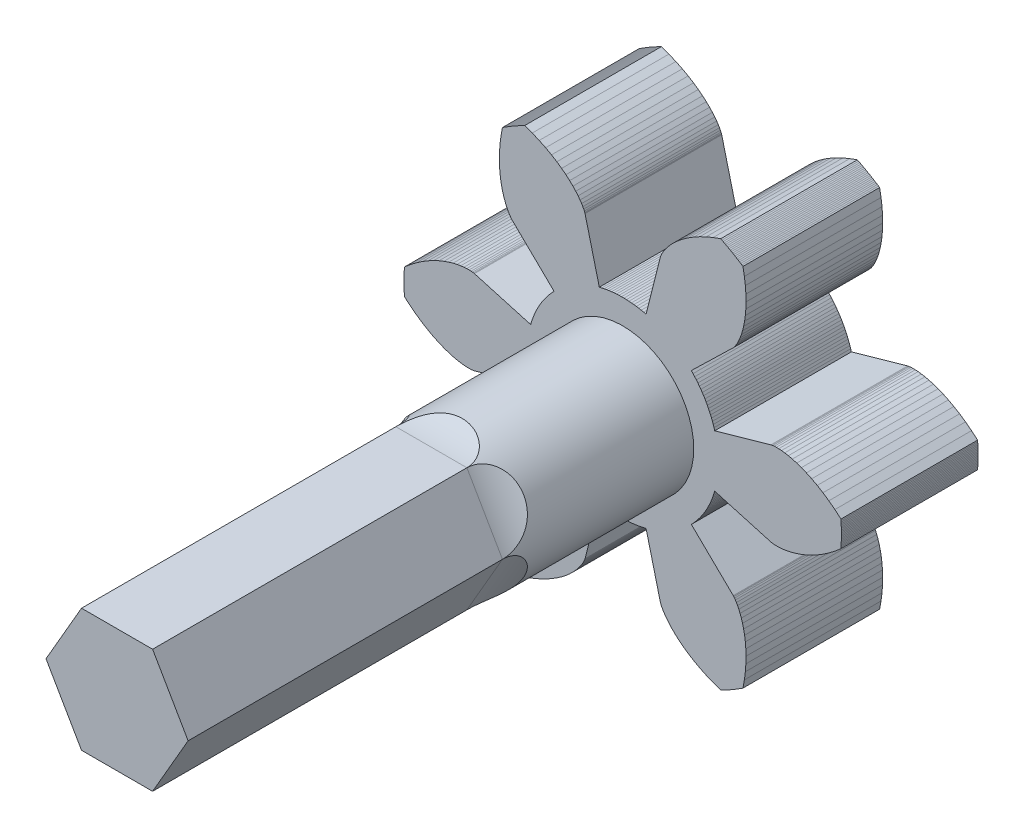
from build123d import *

# Parameters (mm, degrees)
MODEL_R             = 2.6
BOSS_EXTRUDE1_DEPTH = 5
MODEL_2_R           = 2.6
BOSS_EXTRUDE2_DEPTH = 23.5
CUT_EXTRUDE1_REACH  = 28.387
CUT_EXTRUDE1_START  = 5
FILLET2_R           = 2
FILLET3_R           = 2


with BuildPart() as part:
    # Model → Boss-Extrude1 (new body)
    with BuildSketch(Plane.XY):
        Polygon((3.366864, -0.956152), (5.4236867, -1.5402669), (5.4313696, -1.5421583), (5.4546589, -1.5467409), (5.4938176, -1.5523586), (5.5489769, -1.5573371), (5.6201346, -1.5599934), (5.7071553, -1.5586454), (5.8097702, -1.5516211), (5.9275779, -1.5372682), (6.0600461, -1.5139632), (6.2065137, -1.4801209), (6.366193, -1.4342031), (6.5381735, -1.3747278), (6.7214254, -1.3002779), (6.9148042, -1.2095093), (7.1170556, -1.1011596), (7.3268211, -0.9740551), (7.5426441, -0.8271191), (7.7629759, -0.6593782), (7.9861836, -0.4699695), (7.9889386, -0.4205474), (7.9913877, -0.3711091), (7.9935309, -0.3216566), (7.9953681, -0.2721918), (7.9968992, -0.2227166), (7.9981242, -0.1732329), (7.9990429, -0.1237425), (7.9996555, -0.0742474), (7.9999617, -0.0247494), (7.9999617, 0.0247494), (7.9996555, 0.0742474), (7.9990429, 0.1237425), (7.9981242, 0.1732329), (7.9968992, 0.2227166), (7.9953681, 0.2721918), (7.9935309, 0.3216566), (7.9913877, 0.3711091), (7.9889386, 0.4205474), (7.9861836, 0.4699695), (7.7629759, 0.6593782), (7.5426441, 0.8271191), (7.3268211, 0.9740551), (7.1170556, 1.1011596), (6.9148042, 1.2095093), (6.7214254, 1.3002779), (6.5381735, 1.3747278), (6.366193, 1.4342031), (6.2065137, 1.4801209), (6.0600461, 1.5139632), (5.9275779, 1.5372682), (5.8097702, 1.5516211), (5.7071553, 1.5586454), (5.6201346, 1.5599934), (5.5489769, 1.5573371), (5.4938176, 1.5523586), (5.4546589, 1.5467409), (5.4313696, 1.5421583), (5.4236867, 1.5402669), (3.366864, 0.956152), (3.3408805, 1.0433205), (3.3126405, 1.1297844), (3.2821633, 1.2154852), (3.2494693, 1.3003652), (3.2145806, 1.3843668), (3.1775209, 1.4674335), (3.1383151, 1.5495091), (3.0969897, 1.6305381), (3.0535727, 1.710466), (3.0080933, 1.7892386), (2.9605823, 1.8668027), (2.9110718, 1.9431061), (2.8595951, 2.0180971), (2.8061871, 2.0917251), (2.7508839, 2.1639403), (2.6937227, 2.2346941), (2.6347423, 2.3039386), (2.5739823, 2.3716271), (2.511484, 2.4377138), (4.0457536, 3.9269171), (4.051233, 3.9326249), (4.0668464, 3.9505027), (4.0912908, 3.9816063), (4.1231819, 4.0268864), (4.1610612, 4.0871827), (4.2034041, 4.1632188), (4.2486284, 4.255598), (4.2951022, 4.3647989), (4.3411537, 4.4911723), (4.3850791, 4.6349381), (4.4251528, 4.7961833), (4.4596359, 4.9748604), (4.4867863, 5.1707862), (4.5048679, 5.3836414), (4.5121599, 5.6129712), (4.506967, 5.8581857), (4.4876281, 6.1185619), (4.4525262, 6.3932453), (4.4000974, 6.6812531), (4.358674, 6.7083501), (4.3170838, 6.7351902), (4.2753283, 6.7617726), (4.2334091, 6.788096), (4.1913279, 6.8141596), (4.1490862, 6.8399623), (4.1066856, 6.8655031), (4.0641279, 6.8907811), (4.0214145, 6.9157954), (3.9785472, 6.9405448), (3.9355276, 6.9650285), (3.8923573, 6.9892456), (3.849038, 7.0131952), (3.8055714, 7.0368762), (3.761959, 7.0602878), (3.7182027, 7.0834292), (3.674304, 7.1062993), (3.6302646, 7.1288975), (3.5860863, 7.1512227), (3.3104497, 7.0526235), (3.0550159, 6.9456809), (2.8198541, 6.8322408), (2.6048957, 6.7141307), (2.4099363, 6.5931507), (2.234639, 6.471064), (2.0785375, 6.3495882), (1.9410402, 6.2303864), (1.8214345, 6.115059), (1.7188924, 6.0051355), (1.6324756, 5.9020671), (1.5611418, 5.8072191), (1.5037512, 5.7218642), (1.4590734, 5.647176), (1.425795, 5.5842235), (1.4025268, 5.5339649), (1.3878125, 5.4972436), (1.3801366, 5.4747832), (1.3779331, 5.4671839), (0.8553801, 3.3938658), (0.7668981, 3.4149476), (0.6778982, 3.433723), (0.5884405, 3.4501794), (0.4985854, 3.4643055), (0.4083935, 3.4760919), (0.3179258, 3.4855305), (0.2272433, 3.4926151), (0.1364074, 3.4973408), (0.0454794, 3.4997045), (-0.0454794, 3.4997045), (-0.1364074, 3.4973408), (-0.2272433, 3.4926151), (-0.3179258, 3.4855305), (-0.4083935, 3.4760919), (-0.4985854, 3.4643055), (-0.5884405, 3.4501794), (-0.6778982, 3.433723), (-0.7668981, 3.4149476), (-0.8553801, 3.3938658), (-1.3779331, 5.4671839), (-1.3801366, 5.4747832), (-1.3878125, 5.4972436), (-1.4025268, 5.5339649), (-1.425795, 5.5842235), (-1.4590734, 5.647176), (-1.5037512, 5.7218642), (-1.5611418, 5.8072191), (-1.6324756, 5.9020671), (-1.7188924, 6.0051355), (-1.8214345, 6.115059), (-1.9410402, 6.2303864), (-2.0785375, 6.3495882), (-2.234639, 6.471064), (-2.4099363, 6.5931507), (-2.6048957, 6.7141307), (-2.8198541, 6.8322408), (-3.0550159, 6.9456809), (-3.3104497, 7.0526235), (-3.5860863, 7.1512227), (-3.6302646, 7.1288975), (-3.674304, 7.1062993), (-3.7182027, 7.0834292), (-3.761959, 7.0602878), (-3.8055714, 7.0368762), (-3.849038, 7.0131952), (-3.8923573, 6.9892456), (-3.9355276, 6.9650285), (-3.9785472, 6.9405448), (-4.0214145, 6.9157954), (-4.0641279, 6.8907811), (-4.1066856, 6.8655031), (-4.1490862, 6.8399623), (-4.1913279, 6.8141596), (-4.2334091, 6.788096), (-4.2753283, 6.7617726), (-4.3170838, 6.7351902), (-4.358674, 6.7083501), (-4.4000974, 6.6812531), (-4.4525262, 6.3932453), (-4.4876281, 6.1185619), (-4.506967, 5.8581857), (-4.5121599, 5.6129712), (-4.5048679, 5.3836414), (-4.4867863, 5.1707862), (-4.4596359, 4.9748604), (-4.4251528, 4.7961833), (-4.3850791, 4.6349381), (-4.3411537, 4.4911723), (-4.2951022, 4.3647989), (-4.2486284, 4.255598), (-4.2034041, 4.1632188), (-4.1610612, 4.0871827), (-4.1231819, 4.0268864), (-4.0912908, 3.9816063), (-4.0668464, 3.9505027), (-4.051233, 3.9326249), (-4.0457536, 3.9269171), (-2.511484, 2.4377138), (-2.5739823, 2.3716271), (-2.6347423, 2.3039386), (-2.6937227, 2.2346941), (-2.7508839, 2.1639403), (-2.8061871, 2.0917251), (-2.8595951, 2.0180971), (-2.9110718, 1.9431061), (-2.9605823, 1.8668027), (-3.0080933, 1.7892386), (-3.0535727, 1.710466), (-3.0969897, 1.6305381), (-3.1383151, 1.5495091), (-3.1775209, 1.4674335), (-3.2145806, 1.3843668), (-3.2494693, 1.3003652), (-3.2821633, 1.2154852), (-3.3126405, 1.1297844), (-3.3408805, 1.0433205), (-3.366864, 0.956152), (-5.4236867, 1.5402669), (-5.4313696, 1.5421583), (-5.4546589, 1.5467409), (-5.4938176, 1.5523586), (-5.5489769, 1.5573371), (-5.6201346, 1.5599934), (-5.7071553, 1.5586454), (-5.8097702, 1.5516211), (-5.9275779, 1.5372682), (-6.0600461, 1.5139632), (-6.2065137, 1.4801209), (-6.366193, 1.4342031), (-6.5381735, 1.3747278), (-6.7214254, 1.3002779), (-6.9148042, 1.2095093), (-7.1170556, 1.1011596), (-7.3268211, 0.9740551), (-7.5426441, 0.8271191), (-7.7629759, 0.6593782), (-7.9861836, 0.4699695), (-7.9889386, 0.4205474), (-7.9913877, 0.3711091), (-7.9935309, 0.3216566), (-7.9953681, 0.2721918), (-7.9968992, 0.2227166), (-7.9981242, 0.1732329), (-7.9990429, 0.1237425), (-7.9996555, 0.0742474), (-7.9999617, 0.0247494), (-7.9999617, -0.0247494), (-7.9996555, -0.0742474), (-7.9990429, -0.1237425), (-7.9981242, -0.1732329), (-7.9968992, -0.2227166), (-7.9953681, -0.2721918), (-7.9935309, -0.3216566), (-7.9913877, -0.3711091), (-7.9889386, -0.4205474), (-7.9861836, -0.4699695), (-7.7629759, -0.6593782), (-7.5426441, -0.8271191), (-7.3268211, -0.9740551), (-7.1170556, -1.1011596), (-6.9148042, -1.2095093), (-6.7214254, -1.3002779), (-6.5381735, -1.3747278), (-6.366193, -1.4342031), (-6.2065137, -1.4801209), (-6.0600461, -1.5139632), (-5.9275779, -1.5372682), (-5.8097702, -1.5516211), (-5.7071553, -1.5586454), (-5.6201346, -1.5599934), (-5.5489769, -1.5573371), (-5.4938176, -1.5523586), (-5.4546589, -1.5467409), (-5.4313696, -1.5421583), (-5.4236867, -1.5402669), (-3.366864, -0.956152), (-3.3408805, -1.0433205), (-3.3126405, -1.1297844), (-3.2821633, -1.2154852), (-3.2494693, -1.3003652), (-3.2145806, -1.3843668), (-3.1775209, -1.4674335), (-3.1383151, -1.5495091), (-3.0969897, -1.6305381), (-3.0535727, -1.710466), (-3.0080933, -1.7892386), (-2.9605823, -1.8668027), (-2.9110718, -1.9431061), (-2.8595951, -2.0180971), (-2.8061871, -2.0917251), (-2.7508839, -2.1639403), (-2.6937227, -2.2346941), (-2.6347423, -2.3039386), (-2.5739823, -2.3716271), (-2.511484, -2.4377138), (-4.0457536, -3.9269171), (-4.051233, -3.9326249), (-4.0668464, -3.9505027), (-4.0912908, -3.9816063), (-4.1231819, -4.0268864), (-4.1610612, -4.0871827), (-4.2034041, -4.1632188), (-4.2486284, -4.255598), (-4.2951022, -4.3647989), (-4.3411537, -4.4911723), (-4.3850791, -4.6349381), (-4.4251528, -4.7961833), (-4.4596359, -4.9748604), (-4.4867863, -5.1707862), (-4.5048679, -5.3836414), (-4.5121599, -5.6129712), (-4.506967, -5.8581857), (-4.4876281, -6.1185619), (-4.4525262, -6.3932453), (-4.4000974, -6.6812531), (-4.358674, -6.7083501), (-4.3170838, -6.7351902), (-4.2753283, -6.7617726), (-4.2334091, -6.788096), (-4.1913279, -6.8141596), (-4.1490862, -6.8399623), (-4.1066856, -6.8655031), (-4.0641279, -6.8907811), (-4.0214145, -6.9157954), (-3.9785472, -6.9405448), (-3.9355276, -6.9650285), (-3.8923573, -6.9892456), (-3.849038, -7.0131952), (-3.8055714, -7.0368762), (-3.761959, -7.0602878), (-3.7182027, -7.0834292), (-3.674304, -7.1062993), (-3.6302646, -7.1288975), (-3.5860863, -7.1512227), (-3.3104497, -7.0526235), (-3.0550159, -6.9456809), (-2.8198541, -6.8322408), (-2.6048957, -6.7141307), (-2.4099363, -6.5931507), (-2.234639, -6.471064), (-2.0785375, -6.3495882), (-1.9410402, -6.2303864), (-1.8214345, -6.115059), (-1.7188924, -6.0051355), (-1.6324756, -5.9020671), (-1.5611418, -5.8072191), (-1.5037512, -5.7218642), (-1.4590734, -5.647176), (-1.425795, -5.5842235), (-1.4025268, -5.5339649), (-1.3878125, -5.4972436), (-1.3801366, -5.4747832), (-1.3779331, -5.4671839), (-0.8553801, -3.3938658), (-0.7668981, -3.4149476), (-0.6778982, -3.433723), (-0.5884405, -3.4501794), (-0.4985854, -3.4643055), (-0.4083935, -3.4760919), (-0.3179258, -3.4855305), (-0.2272433, -3.4926151), (-0.1364074, -3.4973408), (-0.0454794, -3.4997045), (0.0454794, -3.4997045), (0.1364074, -3.4973408), (0.2272433, -3.4926151), (0.3179258, -3.4855305), (0.4083935, -3.4760919), (0.4985854, -3.4643055), (0.5884405, -3.4501794), (0.6778982, -3.433723), (0.7668981, -3.4149476), (0.8553801, -3.3938658), (1.3779331, -5.4671839), (1.3801366, -5.4747832), (1.3878125, -5.4972436), (1.4025268, -5.5339649), (1.425795, -5.5842235), (1.4590734, -5.647176), (1.5037512, -5.7218642), (1.5611418, -5.8072191), (1.6324756, -5.9020671), (1.7188924, -6.0051355), (1.8214345, -6.115059), (1.9410402, -6.2303864), (2.0785375, -6.3495882), (2.234639, -6.471064), (2.4099363, -6.5931507), (2.6048957, -6.7141307), (2.8198541, -6.8322408), (3.0550159, -6.9456809), (3.3104497, -7.0526235), (3.5860863, -7.1512227), (3.6302646, -7.1288975), (3.674304, -7.1062993), (3.7182027, -7.0834292), (3.761959, -7.0602878), (3.8055714, -7.0368762), (3.849038, -7.0131952), (3.8923573, -6.9892456), (3.9355276, -6.9650285), (3.9785472, -6.9405448), (4.0214145, -6.9157954), (4.0641279, -6.8907811), (4.1066856, -6.8655031), (4.1490862, -6.8399623), (4.1913279, -6.8141596), (4.2334091, -6.788096), (4.2753283, -6.7617726), (4.3170838, -6.7351902), (4.358674, -6.7083501), (4.4000974, -6.6812531), (4.4525262, -6.3932453), (4.4876281, -6.1185619), (4.506967, -5.8581857), (4.5121599, -5.6129712), (4.5048679, -5.3836414), (4.4867863, -5.1707862), (4.4596359, -4.9748604), (4.4251528, -4.7961833), (4.3850791, -4.6349381), (4.3411537, -4.4911723), (4.2951022, -4.3647989), (4.2486284, -4.255598), (4.2034041, -4.1632188), (4.1610612, -4.0871827), (4.1231819, -4.0268864), (4.0912908, -3.9816063), (4.0668464, -3.9505027), (4.051233, -3.9326249), (4.0457536, -3.9269171), (2.511484, -2.4377138), (2.5739823, -2.3716271), (2.6347423, -2.3039386), (2.6937227, -2.2346941), (2.7508839, -2.1639403), (2.8061871, -2.0917251), (2.8595951, -2.0180971), (2.9110718, -1.9431061), (2.9605823, -1.8668027), (3.0080933, -1.7892386), (3.0535727, -1.710466), (3.0969897, -1.6305381), (3.1383151, -1.5495091), (3.1775209, -1.4674335), (3.2145806, -1.3843668), (3.2494693, -1.3003652), (3.2821633, -1.2154852), (3.3126405, -1.1297844), (3.3408805, -1.0433205), align=None)
        Circle(MODEL_R, mode=Mode.SUBTRACT)
    extrude(amount=BOSS_EXTRUDE1_DEPTH)

    # Model<2> → Boss-Extrude2 (add)
    with BuildSketch(Plane.XY):
        Circle(MODEL_2_R)
    extrude(amount=BOSS_EXTRUDE2_DEPTH)

    # Sketch1 → Cut-Extrude1 (cut, up to next)
    with BuildSketch(Plane.XY.offset(5).offset(CUT_EXTRUDE1_START), mode=Mode.PRIVATE) as cut_extrude1_sk1:
        with BuildLine():
            ThreePointArc((-2.6, 0), (-2.25166605, -1.3), (-1.3, -2.25166605))
            Line((-1.3, -2.25166605), (-2.6, 0))
        make_face()
    cut_extrude1_tool1 = extrude(cut_extrude1_sk1.sketch, amount=CUT_EXTRUDE1_REACH, mode=Mode.PRIVATE) & part.part
    # Sketch1 → Cut-Extrude1 (cut, up to next)
    with BuildSketch(Plane.XY.offset(5).offset(CUT_EXTRUDE1_START), mode=Mode.PRIVATE) as cut_extrude1_sk2:
        with BuildLine():
            ThreePointArc((-1.3, -2.25166605), (0, -2.6), (1.3, -2.25166605))
            Line((1.3, -2.25166605), (-1.3, -2.25166605))
        make_face()
    cut_extrude1_tool2 = extrude(cut_extrude1_sk2.sketch, amount=CUT_EXTRUDE1_REACH, mode=Mode.PRIVATE) & part.part
    # Sketch1 → Cut-Extrude1 (cut, up to next)
    with BuildSketch(Plane.XY.offset(5).offset(CUT_EXTRUDE1_START), mode=Mode.PRIVATE) as cut_extrude1_sk3:
        with BuildLine():
            ThreePointArc((1.3, -2.25166605), (2.25166605, -1.3), (2.6, 0))
            Line((2.6, 0), (1.3, -2.25166605))
        make_face()
    cut_extrude1_tool3 = extrude(cut_extrude1_sk3.sketch, amount=CUT_EXTRUDE1_REACH, mode=Mode.PRIVATE) & part.part
    # Sketch1 → Cut-Extrude1 (cut, up to next)
    with BuildSketch(Plane.XY.offset(5).offset(CUT_EXTRUDE1_START), mode=Mode.PRIVATE) as cut_extrude1_sk4:
        with BuildLine():
            Line((1.3, 2.25166605), (2.6, 0))
            ThreePointArc((2.6, 0), (2.25166605, 1.3), (1.3, 2.25166605))
        make_face()
    cut_extrude1_tool4 = extrude(cut_extrude1_sk4.sketch, amount=CUT_EXTRUDE1_REACH, mode=Mode.PRIVATE) & part.part
    # Sketch1 → Cut-Extrude1 (cut, up to next)
    with BuildSketch(Plane.XY.offset(5).offset(CUT_EXTRUDE1_START), mode=Mode.PRIVATE) as cut_extrude1_sk5:
        with BuildLine():
            Line((-2.6, 0), (-1.3, 2.25166605))
            ThreePointArc((-1.3, 2.25166605), (-2.25166605, 1.3), (-2.6, 0))
        make_face()
    cut_extrude1_tool5 = extrude(cut_extrude1_sk5.sketch, amount=CUT_EXTRUDE1_REACH, mode=Mode.PRIVATE) & part.part
    # Sketch1 → Cut-Extrude1 (cut, up to next)
    with BuildSketch(Plane.XY.offset(5).offset(CUT_EXTRUDE1_START), mode=Mode.PRIVATE) as cut_extrude1_sk6:
        with BuildLine():
            Line((-1.3, 2.25166605), (1.3, 2.25166605))
            ThreePointArc((1.3, 2.25166605), (0, 2.6), (-1.3, 2.25166605))
        make_face()
    cut_extrude1_tool6 = extrude(cut_extrude1_sk6.sketch, amount=CUT_EXTRUDE1_REACH, mode=Mode.PRIVATE) & part.part
    add(cut_extrude1_tool1.solids().sort_by_distance((-2.071387, -1.195916, 10))[0], mode=Mode.SUBTRACT)
    add(cut_extrude1_tool2.solids().sort_by_distance((0, -2.391832, 10))[0], mode=Mode.SUBTRACT)
    add(cut_extrude1_tool3.solids().sort_by_distance((2.071387, -1.195916, 10))[0], mode=Mode.SUBTRACT)
    add(cut_extrude1_tool4.solids().sort_by_distance((2.071387, 1.195916, 10))[0], mode=Mode.SUBTRACT)
    add(cut_extrude1_tool5.solids().sort_by_distance((-2.071387, 1.195916, 10))[0], mode=Mode.SUBTRACT)
    add(cut_extrude1_tool6.solids().sort_by_distance((0, 2.391832, 10))[0], mode=Mode.SUBTRACT)

    # Fillet2
    # the kernel refuses this fillet: 2 mm, written as the material it adds along each edge
    with BuildSketch(Plane(origin=(-6.3, 2.25166605, 10), x_dir=(0, 1, 0), z_dir=(1, 0, 0))) as fillet2_piece_1_section:
        with BuildLine():
            CenterArc((FILLET2_R, FILLET2_R), FILLET2_R, 180, 90)
            Line((0, FILLET2_R), (0, 0))
            Line((0, 0), (FILLET2_R, 0))
        make_face()
    fillet2_piece_1 = extrude(amount=12.6, mode=Mode.PRIVATE)
    fillet2_piece_1 = fillet2_piece_1 & Plane(origin=(0, 0, 10.684361634), x_dir=(1, 0, 0), z_dir=(0, 0, -1)) * Cylinder(2.6, 34, mode=Mode.PRIVATE)
    add(fillet2_piece_1)
    with BuildSketch(Plane(origin=(1.2, -6.581793069, 10), x_dir=(-0.8660254037844346, -0.5000000000000072, 0), z_dir=(-0.5000000000000071, 0.8660254037844346, 0))) as fillet2_piece_2_section:
        with BuildLine():
            CenterArc((FILLET2_R, FILLET2_R), FILLET2_R, 180, 90)
            Line((0, FILLET2_R), (0, 0))
            Line((0, 0), (FILLET2_R, 0))
        make_face()
    fillet2_piece_2 = extrude(amount=12.6, mode=Mode.PRIVATE)
    fillet2_piece_2 = fillet2_piece_2 & Plane(origin=(0, 0, 10.684361634), x_dir=(1, 0, 0), z_dir=(0, 0, -1)) * Cylinder(2.6, 34, mode=Mode.PRIVATE)
    add(fillet2_piece_2)
    with BuildSketch(Plane(origin=(5.1, 4.330127019, 10), x_dir=(0.8660254037844415, -0.4999999999999951, 0), z_dir=(-0.4999999999999951, -0.8660254037844415, 0))) as fillet2_piece_3_section:
        with BuildLine():
            CenterArc((FILLET2_R, FILLET2_R), FILLET2_R, 180, 90)
            Line((0, FILLET2_R), (0, 0))
            Line((0, 0), (FILLET2_R, 0))
        make_face()
    fillet2_piece_3 = extrude(amount=12.6, mode=Mode.PRIVATE)
    fillet2_piece_3 = fillet2_piece_3 & Plane(origin=(0, 0, 10.684361634), x_dir=(1, 0, 0), z_dir=(0, 0, -1)) * Cylinder(2.6, 34, mode=Mode.PRIVATE)
    add(fillet2_piece_3)

    # Fillet3
    # the kernel refuses this fillet: 2 mm, written as the material it adds along each edge
    with BuildSketch(Plane(origin=(-1.2, 6.581793069, 10), x_dir=(0, 0, 1), z_dir=(0.5000000000000012, -0.8660254037844379, 0))) as fillet3_piece_1_section:
        with BuildLine():
            CenterArc((FILLET3_R, -FILLET3_R), FILLET3_R, 90, 90)
            Line((0, -FILLET3_R), (0, 0))
            Line((0, 0), (FILLET3_R, 0))
        make_face()
    fillet3_piece_1 = extrude(amount=12.6, mode=Mode.PRIVATE)
    fillet3_piece_1 = fillet3_piece_1 & Plane(origin=(0, 0, 10.684361315), x_dir=(1, 0, 0), z_dir=(0, 0, -1)) * Cylinder(2.6, 34, mode=Mode.PRIVATE)
    add(fillet3_piece_1)
    with BuildSketch(Plane(origin=(6.3, -2.25166605, 10), x_dir=(0, 0, 1), z_dir=(-1, 0, 0))) as fillet3_piece_2_section:
        with BuildLine():
            CenterArc((FILLET3_R, -FILLET3_R), FILLET3_R, 90, 90)
            Line((0, -FILLET3_R), (0, 0))
            Line((0, 0), (FILLET3_R, 0))
        make_face()
    fillet3_piece_2 = extrude(amount=12.6, mode=Mode.PRIVATE)
    fillet3_piece_2 = fillet3_piece_2 & Plane(origin=(0, 0, 10.684361227), x_dir=(1, 0, 0), z_dir=(0, 0, -1)) * Cylinder(2.6, 34, mode=Mode.PRIVATE)
    add(fillet3_piece_2)
    with BuildSketch(Plane(origin=(-5.1, -4.330127019, 10), x_dir=(-0.8660254037844415, 0.49999999999999506, 0), z_dir=(0.49999999999999506, 0.8660254037844415, 0))) as fillet3_piece_3_section:
        with BuildLine():
            CenterArc((FILLET3_R, FILLET3_R), FILLET3_R, 180, 90)
            Line((0, FILLET3_R), (0, 0))
            Line((0, 0), (FILLET3_R, 0))
        make_face()
    fillet3_piece_3 = extrude(amount=12.6, mode=Mode.PRIVATE)
    fillet3_piece_3 = fillet3_piece_3 & Plane(origin=(0, 0, 10.684361634), x_dir=(1, 0, 0), z_dir=(0, 0, -1)) * Cylinder(2.6, 34, mode=Mode.PRIVATE)
    add(fillet3_piece_3)


solid = part.part
